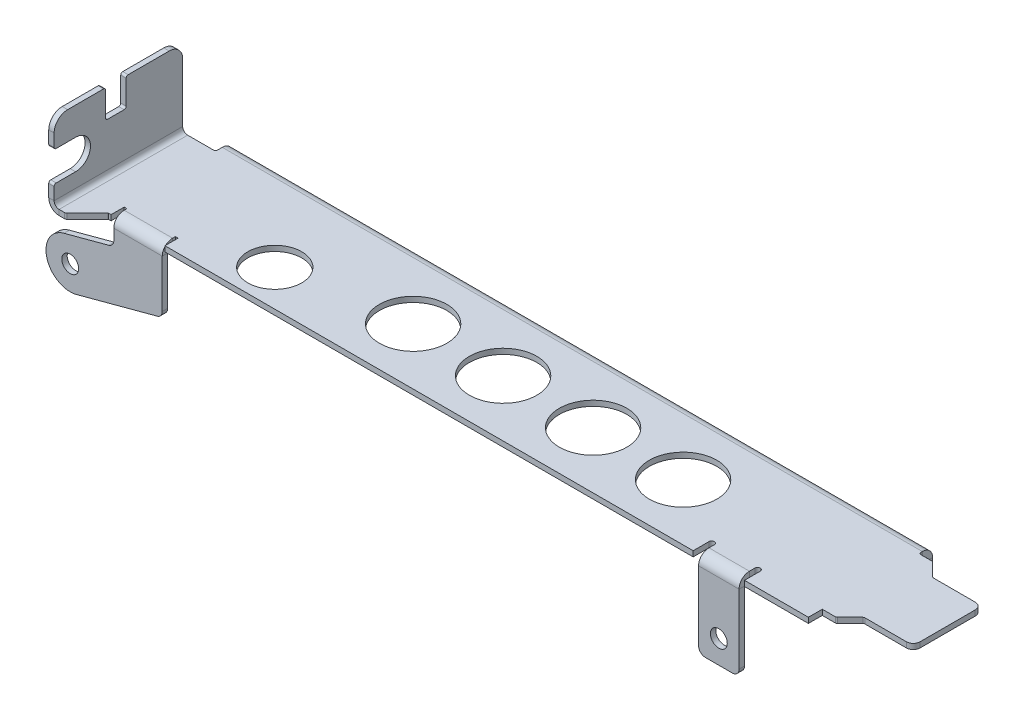
from build123d import *

# Parameters (mm, degrees)
BASE_FLANGE1_DEPTH            = 0.8
EDGE_FLANGE1_STRIP_W          = 4.6732
EDGE_FLANGE1_STRIP_H          = 0.8
EDGE_FLANGE1_STRIP_CUT_DEPTH  = 19.05
EDGE_FLANGE1_DEPTH            = 19.05
EDGE_FLANGE1_START            = 0.8
EDGE_FLANGE1_FLAT_DEPTH       = 0.8
CHAMFER2_SIZE                 = 3.17
EDGE_FLANGE2_START            = -1.5366
EDGE_FLANGE2_DEPTH            = 2.5366
EDGE_FLANGE2_START_2          = -0.084496
EDGE_FLANGE2_2_OUTLINE_W      = 6
EDGE_FLANGE2_2_OUTLINE_H      = 0.8
EDGE_FLANGE2_2_DEPTH          = 1.084496
EDGE_FLANGE2_START_3          = -12.8
EDGE_FLANGE2_3_OUTLINE_W      = 6
EDGE_FLANGE2_3_OUTLINE_H      = 0.8
EDGE_FLANGE2_3_DEPTH          = 11.2634
EDGE_FLANGE2_START_4          = -27.694130054
EDGE_FLANGE2_4_DEPTH          = 6
EDGE_FLANGE2_5_DEPTH          = 6
EDGE_FLANGE4_STRIP_W          = 4.6732
EDGE_FLANGE4_STRIP_H          = 0.8
EDGE_FLANGE4_STRIP_CUT_DEPTH  = 7.17999872
EDGE_FLANGE4_RELIEF_W         = 5.0732
EDGE_FLANGE4_RELIEF_H         = 0.4
EDGE_FLANGE4_RELIEF_CUT_DEPTH = 0.8
EDGE_FLANGE4_DEPTH            = 7.17999872
EDGE_FLANGE4_FLAT_DEPTH       = 0.8
M3X0_5_TAPPED_HOLE1_D         = 2.5
EDGE_FLANGE3_STRIP_W          = 4.6732
EDGE_FLANGE3_STRIP_H          = 0.8
EDGE_FLANGE3_STRIP_CUT_DEPTH  = 103.732625794
EDGE_FLANGE3_DEPTH            = 103.732625794
SKETCH21_R                    = 5
SKETCH21_R_2                  = 4
CUT_EXTRUDE1_DEPTH            = 126.679221242
FILLET1_R                     = 1
FILLET3_R                     = 2
FILLET4_R                     = 0.3
FILLET5_R                     = 1


with BuildPart() as part:
    # Base-Flange1: sheet metal written as solids
    # Sketch2 → Base-Flange1 (new body)
    with BuildSketch(Plane(origin=(0, 0, 0), x_dir=(1, 0, 0), z_dir=(0, 1, 0))):
        Polygon((-115.1509, -12.3825), (-120.015, -12.3825), (-120.015, 6.6675), (-115.1509, 6.6675), (-115.1509, 9.2075), (-11.418274206, 9.2075), (-11.418274206, 7.1501), (-9.360874206, 7.1501), (-7.303474206, 5.0927), (0, 5.0927), (0, -5.0927), (-7.303474206, -5.0927), (-9.360874206, -7.1501), (-11.418274206, -7.1501), (-11.418274206, -9.2075), (-115.1509, -9.2075), align=None)
    extrude(amount=-BASE_FLANGE1_DEPTH)

    # Edge-Flange1: sheet metal written as solids
    # Edge-Flange1 strip (on a plane across the edge) → Edge-Flange1 strip cut (cut)
    with BuildSketch(Plane(origin=(-120.015, 0, -6.6675), x_dir=(1, 0, 0), z_dir=(0, 0, 1))):
        with Locations((-1.6, -0.4)):
            Rectangle(EDGE_FLANGE1_STRIP_W, EDGE_FLANGE1_STRIP_H)
    extrude(amount=EDGE_FLANGE1_STRIP_CUT_DEPTH, mode=Mode.SUBTRACT)

    # Edge-Flange1 bend section (on a plane across the edge) → Edge-Flange1 (add)
    with BuildSketch(Plane(origin=(-120.015, 0, -6.6675), x_dir=(1, 0, 0), z_dir=(0, 0, 1))):
        with BuildLine():
            Line((-0.8, 0.7366), (0, 0.7366))
            ThreePointArc((0, 0.7366), (0.215745145, 0.215745145), (0.7366, 0))
            Line((0.7366, 0), (0.7366, -0.8))
            ThreePointArc((0.7366, -0.8), (-0.34994028, -0.34994028), (-0.8, 0.7366))
        make_face()
    extrude(amount=EDGE_FLANGE1_DEPTH)

    # Edge-Flange1 profile (on flange) → Edge-Flange1 flat (add)
    with BuildSketch(Plane.ZY.offset(120.015).offset(EDGE_FLANGE1_START)):
        with BuildLine():
            ThreePointArc((9.2075, 2.8702), (6.9977, 5.08), (9.2075, 7.2898))
            Line((9.2075, 7.2898), (12.3825, 7.2898))
            Line((12.3825, 7.2898), (12.3825, 11.43))
            Line((12.3825, 11.43), (4.7625, 11.43))
            Line((4.7625, 11.43), (4.7625, 7.239))
            Line((4.7625, 7.239), (1.7145, 7.239))
            Line((1.7145, 7.239), (1.7145, 11.43))
            Line((1.7145, 11.43), (-6.6675, 11.43))
            Line((-6.6675, 11.43), (-6.6675, 0.7366))
            Line((-6.6675, 0.7366), (12.3825, 0.7366))
            Line((12.3825, 0.7366), (12.3825, 2.8702))
            Line((12.3825, 2.8702), (9.2075, 2.8702))
        make_face()
    extrude(amount=-EDGE_FLANGE1_FLAT_DEPTH)

    # Chamfer2
    chamfer2_edges = [part.edges().sort_by_distance(p)[0] for p in [
        (-115.1509, -0.4, 12.3825),
    ]]
    chamfer(chamfer2_edges, length=CHAMFER2_SIZE)

    # Edge-Flange2: read off the stored shape, not the designer's step
    # Edge-Flange2 outline → Edge-Flange2 (cut)
    with BuildSketch(Plane(origin=(0, 0, 0), x_dir=(1, 0, 0), z_dir=(0, 1, 0)).offset(EDGE_FLANGE2_START)):
        with BuildLine():
            Line((-28.494130054, -9.2075), (-27.694130054, -9.2075))
            Line((-27.694130054, -9.2075), (-27.694130054, -6.8709))
            ThreePointArc((-27.694130054, -6.8709), (-28.094130054, -6.4709), (-28.494130054, -6.8709))
            Line((-28.494130054, -6.8709), (-28.494130054, -9.2075))
        make_face()
        with BuildLine():
            Line((-21.694130054, -6.8709), (-21.694130054, -9.2075))
            Line((-21.694130054, -9.2075), (-20.894130054, -9.2075))
            Line((-20.894130054, -9.2075), (-20.894130054, -6.8709))
            ThreePointArc((-20.894130054, -6.8709), (-21.294130054, -6.4709), (-21.694130054, -6.8709))
        make_face()
    extrude(amount=EDGE_FLANGE2_DEPTH, mode=Mode.SUBTRACT)

    # Edge-Flange2 2 outline → Edge-Flange2 2 (cut)
    with BuildSketch(Plane(origin=(0, 0, 0), x_dir=(1, 0, 0), z_dir=(0, 1, 0)).offset(EDGE_FLANGE2_START_2)):
        with Locations((-24.694130054, -8.8075)):
            Rectangle(EDGE_FLANGE2_2_OUTLINE_W, EDGE_FLANGE2_2_OUTLINE_H)
    extrude(amount=EDGE_FLANGE2_2_DEPTH, mode=Mode.SUBTRACT)

    # Edge-Flange2 4 outline → Edge-Flange2 4 (cut)
    with BuildSketch(Plane.YZ.offset(EDGE_FLANGE2_START_4)):
        with BuildLine():
            Line((-0.8, 9.2075), (-0.8, 9.019439951))
            ThreePointArc((-0.8, 9.019439951), (-0.215048049, 8.454889796), (0, 7.6709))
            Line((0, 7.6709), (0, 8.4075))
            Line((0, 8.4075), (-0.084496, 8.4075))
            Line((-0.084496, 8.4075), (-0.084496, 9.2075))
            Line((-0.084496, 9.2075), (-0.8, 9.2075))
        make_face()
    extrude(amount=EDGE_FLANGE2_4_DEPTH, mode=Mode.SUBTRACT)



with BuildPart() as body_2:
    # Edge-Flange2 3 outline → Edge-Flange2 3 (new body)
    with BuildSketch(Plane(origin=(0, 0, 0), x_dir=(1, 0, 0), z_dir=(0, 1, 0)).offset(EDGE_FLANGE2_START_3)):
        with Locations((-24.694130054, -8.8075)):
            Rectangle(EDGE_FLANGE2_3_OUTLINE_W, EDGE_FLANGE2_3_OUTLINE_H)
    extrude(amount=EDGE_FLANGE2_3_DEPTH)


with BuildPart() as part_1:
    add(part.part)

    add(body_2.part)  # Edge-Flange2 5 merges body 2
    # Edge-Flange2 5 outline → Edge-Flange2 5 (add)
    with BuildSketch(Plane.YZ.offset(EDGE_FLANGE2_START_4)):
        with BuildLine():
            ThreePointArc((-0.8, 9.019439951), (-1.156486155, 9.159742848), (-1.5366, 9.2075))
            Line((-1.5366, 9.2075), (-1.5366, 8.4075))
            ThreePointArc((-1.5366, 8.4075), (-1.015745145, 8.191754855), (-0.8, 7.6709))
            Line((-0.8, 7.6709), (-0.8, 9.019439951))
        make_face()
    extrude(amount=EDGE_FLANGE2_5_DEPTH)

    # Edge-Flange4: sheet metal written as solids
    # Edge-Flange4 strip (on a plane across the edge) → Edge-Flange4 strip cut (cut)
    with BuildSketch(Plane(origin=(-107.17090128, -0.8, 9.2075), x_dir=(0, 0, -1), z_dir=(-1, 0, 0))):
        with Locations((-0.8, -0.4)):
            Rectangle(EDGE_FLANGE4_STRIP_W, EDGE_FLANGE4_STRIP_H)
    extrude(amount=EDGE_FLANGE4_STRIP_CUT_DEPTH, mode=Mode.SUBTRACT)

    # Edge-Flange4 relief (on the sheet) → Edge-Flange4 relief cut (cut)
    with BuildSketch(Plane(origin=(-107.17090128, -0.8, 7.6709), x_dir=(0, 0, -1), z_dir=(0, -1, 0))):
        with Locations((-2.1366, 0.2)):
            Rectangle(EDGE_FLANGE4_RELIEF_W, EDGE_FLANGE4_RELIEF_H)
        with Locations((-2.1366, -7.37999872)):
            Rectangle(EDGE_FLANGE4_RELIEF_W, EDGE_FLANGE4_RELIEF_H)
    extrude(amount=-EDGE_FLANGE4_RELIEF_CUT_DEPTH, mode=Mode.SUBTRACT)

    # Edge-Flange4 bend section (on a plane across the edge) → Edge-Flange4 (add)
    with BuildSketch(Plane(origin=(-107.17090128, -0.8, 9.2075), x_dir=(0, 0, -1), z_dir=(-1, 0, 0))):
        with BuildLine():
            Line((0, 0.7366), (0.8, 0.7366))
            ThreePointArc((0.8, 0.7366), (1.015745145, 0.215745145), (1.5366, 0))
            Line((1.5366, 0), (1.5366, -0.8))
            ThreePointArc((1.5366, -0.8), (0.45005972, -0.34994028), (0, 0.7366))
        make_face()
    extrude(amount=EDGE_FLANGE4_DEPTH)

    # Edge-Flange4 profile (on flange) → Edge-Flange4 flat (add)
    with BuildSketch(Plane(origin=(0, -0.8, 9.2075), x_dir=(-1, 0, 0), z_dir=(0, 0, 1))):
        with BuildLine():
            ThreePointArc((121.735691381, 5.082325102), (124.274204272, 9.479158406), (119.877370968, 12.017671298))
            Line((119.877370968, 12.017671298), (107.17090128, 8.612983007))
            Line((107.17090128, 8.612983007), (107.17090128, 0.7366))
            Line((107.17090128, 0.7366), (114.3509, 0.7366))
            Line((114.3509, 0.7366), (114.3509, 3.103576215))
            Line((114.3509, 3.103576215), (121.735691381, 5.082325102))
        make_face()
    extrude(amount=-EDGE_FLANGE4_FLAT_DEPTH)

    # M3x0.5 Tapped Hole1 (through all)
    with Locations(Plane.XY.offset(9.2075)):
        with Locations((-120.806531174, -9.3499982), (-24.694130054, -9.36023907)):
            Hole(M3X0_5_TAPPED_HOLE1_D / 2)

    # Edge-Flange3: sheet metal written as solids
    # Edge-Flange3 strip (on a plane across the edge) → Edge-Flange3 strip cut (cut)
    with BuildSketch(Plane(origin=(-115.1509, -0.8, -9.2075), x_dir=(0, 0, 1), z_dir=(1, 0, 0))):
        with Locations((-0.8, -0.4)):
            Rectangle(EDGE_FLANGE3_STRIP_W, EDGE_FLANGE3_STRIP_H)
    extrude(amount=EDGE_FLANGE3_STRIP_CUT_DEPTH, mode=Mode.SUBTRACT)

    # Edge-Flange3 section (on a plane across the edge) → Edge-Flange3 (add)
    with BuildSketch(Plane(origin=(-115.1509, -0.8, -9.2075), x_dir=(0, 0, 1), z_dir=(1, 0, 0))):
        with BuildLine():
            Line((0, 0.7366), (0, 1.8))
            Line((0, 1.8), (0.8, 1.8))
            Line((0.8, 1.8), (0.8, 0.7366))
            ThreePointArc((0.8, 0.7366), (1.015745145, 0.215745145), (1.5366, 0))
            Line((1.5366, 0), (1.5366, -0.8))
            ThreePointArc((1.5366, -0.8), (0.45005972, -0.34994028), (0, 0.7366))
        make_face()
    extrude(amount=EDGE_FLANGE3_DEPTH)

    # Sketch21 → Cut-Extrude1 (cut, through all)
    with BuildSketch(Plane(origin=(0, 0, 0), x_dir=(1, 0, 0), z_dir=(0, 1, 0))):
        with Locations(Location((-78.363042127, -0.838303057, 0), (0, 0, 270))):
            Circle(SKETCH21_R)
        with Locations(Location((-95.863042127, -3.838303057, 0), (0, 0, 270))):
            Circle(SKETCH21_R_2)
        with Locations(Location((-65.028050672, -0.838303057, 0), (0, 0, 270))):
            Circle(SKETCH21_R)
        with Locations(Location((-51.693043958, -0.838303057, 0), (0, 0, 270))):
            Circle(SKETCH21_R)
        with Locations(Location((-38.358052503, -0.838303057, 0), (0, 0, 270))):
            Circle(SKETCH21_R)
    extrude(amount=-CUT_EXTRUDE1_DEPTH, mode=Mode.SUBTRACT)

    # Fillet1
    fillet1_edges = [part_1.edges().sort_by_distance(p)[0] for p in [
        (0, -0.4, -5.0927),
        (0, -0.4, 5.0927),
    ]]
    fillet(fillet1_edges, radius=FILLET1_R)

    # Fillet3
    fillet3_edges = [part_1.edges().sort_by_distance(p)[0] for p in [
        (-120.415, 11.43, -6.6675),
        (-120.415, 11.43, 12.3825),
    ]]
    fillet(fillet3_edges, radius=FILLET3_R)

    # Fillet4
    # the kernel refuses this fillet: 0.3 mm, written as the material it adds along each edge
    with BuildSketch(Plane(origin=(-115.1509, 0, -6.6675), x_dir=(-1, 0, 0), z_dir=(0, -1, 0))) as fillet4_piece_1:
        with BuildLine():
            CenterArc((FILLET4_R, FILLET4_R), FILLET4_R, 180, 90)
            Line((0, FILLET4_R), (0, 0))
            Line((0, 0), (FILLET4_R, 0))
        make_face()
    extrude(amount=0.8)
    with BuildSketch(Plane(origin=(-11.418274206, 0, -7.1501), x_dir=(1, 0, 0), z_dir=(0, -1, 0)), Plane(origin=(-120.815, 7.239, 4.7625), x_dir=(0, 1, 0), z_dir=(1, 0, 0)), Plane(origin=(-120.815, 7.239, 1.7145), x_dir=(0, 0, 1), z_dir=(1, 0, 0))) as fillet4_piece_2:
        with BuildLine():
            CenterArc((FILLET4_R, -FILLET4_R), FILLET4_R, 90, 90)
            Line((0, -FILLET4_R), (0, 0))
            Line((0, 0), (FILLET4_R, 0))
        make_face()
    extrude(amount=0.8)
    with BuildSketch(Plane(origin=(-7.303474206, 0, -5.0927), x_dir=(1, 0, 0), z_dir=(0, -1, 0))) as fillet4_piece_3:
        with BuildLine():
            CenterArc((FILLET4_R * 0.414213562373, -FILLET4_R), FILLET4_R, 90, 45)
            Line((-FILLET4_R * 0.292893218813, -FILLET4_R * 0.292893218813), (0, 0))
            Line((0, 0), (FILLET4_R * 0.414213562373, 0))
        make_face()
    extrude(amount=0.8)
    with BuildSketch(Plane(origin=(-7.303474206, 0, 5.0927), x_dir=(1, 0, 0), z_dir=(0, -1, 0))) as fillet4_piece_4:
        with BuildLine():
            CenterArc((FILLET4_R * 0.414213562373, FILLET4_R), FILLET4_R, 225, 45)
            Line((-FILLET4_R * 0.292893218813, FILLET4_R * 0.292893218813), (0, 0))
            Line((0, 0), (FILLET4_R * 0.414213562373, 0))
        make_face()
    extrude(amount=0.8)
    # the kernel refuses this fillet: 0.3 mm, written as the material it takes off along each edge
    with BuildSketch(Plane(origin=(-115.1509, 0.1059659, 9.2125), x_dir=(-0.7071067811864428, 0, 0.7071067811866523), z_dir=(0, -1, 0))) as fillet4_2_piece_1:
        with BuildLine():
            CenterArc((0.04238636, 0.3), FILLET4_R, 261.194947533, 8.805052467)
            Line((-0.003535534, 0.003535534), (0, 0))
            Line((0, 0), (0.04238636, 0))
        make_face()
    extrude(amount=1.0119318, mode=Mode.SUBTRACT)
    with BuildSketch(Plane(origin=(-9.360874206, 0.310660172, 7.1501), x_dir=(-1, 0, 0), z_dir=(0, -1, 0)), Plane(origin=(-118.3209, 0.310660172, 12.3825), x_dir=(-1, 0, 0), z_dir=(0, -1, 0))) as fillet4_2_piece_2:
        with BuildLine():
            CenterArc((FILLET4_R * 0.414213562373, FILLET4_R), FILLET4_R, 225, 45)
            Line((-FILLET4_R * 0.292893218813, FILLET4_R * 0.292893218813), (0, 0))
            Line((0, 0), (FILLET4_R * 0.414213562373, 0))
        make_face()
    extrude(amount=1.421320344, mode=Mode.SUBTRACT)
    with BuildSketch(Plane(origin=(-121.565, 2.8702, 12.3825), x_dir=(0, 0, -1), z_dir=(1, 0, 0)), Plane(origin=(-121.565, 7.2898, 12.3825), x_dir=(0, 1, 0), z_dir=(1, 0, 0)), Plane(origin=(-121.565, 11.43, 4.7625), x_dir=(0, -1, 0), z_dir=(1, 0, 0)), Plane(origin=(-121.565, 11.43, 1.7145), x_dir=(0, 0, -1), z_dir=(1, 0, 0))) as fillet4_2_piece_3:
        with BuildLine():
            CenterArc((FILLET4_R, -FILLET4_R), FILLET4_R, 90, 90)
            Line((0, -FILLET4_R), (0, 0))
            Line((0, 0), (FILLET4_R, 0))
        make_face()
    extrude(amount=2.3, mode=Mode.SUBTRACT)

    # Fillet5
    fillet5_edges = [part_1.edges().sort_by_distance(p)[0] for p in [
        (-21.694130054, -12.8, 8.8075),
        (-27.694130054, -12.8, 8.8075),
        (-107.17090128, -9.412983007, 8.8075),
        (-114.3509, -3.903576215, 8.8075),
    ]]
    fillet(fillet5_edges, radius=FILLET5_R)


solid = part_1.part
